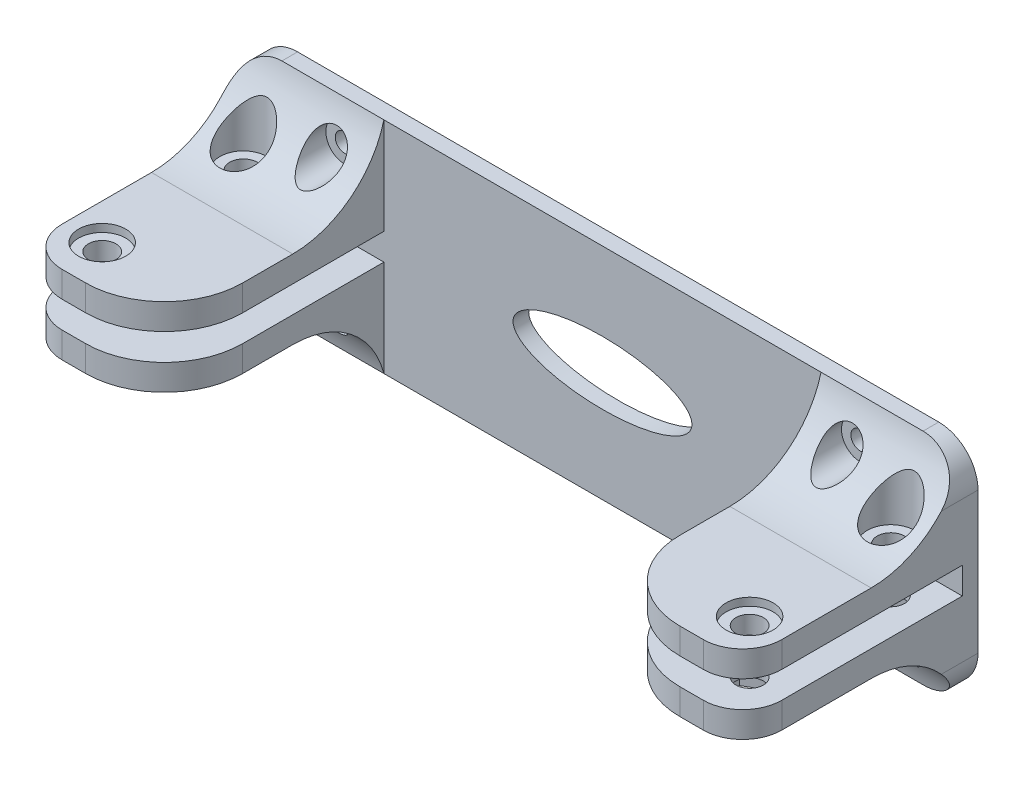
from build123d import *

# Parameters (mm, degrees)
SKETCH2_W           = 91.7
SKETCH2_H           = 28
SKETCH2_R           = 1.2
BOSS_EXTRUDE1_DEPTH = 2
SKETCH3_W           = 28
SKETCH3_H           = 10
BOSS_EXTRUDE2_DEPTH = 18
SKETCH4_R           = 1.75
CUT_EXTRUDE1_DEPTH  = 58.993297026
FILLET3_R           = 5
FILLET4_R           = 10
CUT_EXTRUDE2_REACH  = 58.553
SKETCH5_W           = 5
SKETCH5_H           = 3.4
SKETCH5_W_2         = 3
SKETCH5_W_3         = 10
FILLET1_R           = 12
SKETCH6_R           = 2.4
CUT_EXTRUDE3_DEPTH  = 56.517767534
SKETCH7_RX          = 11.396995787
SKETCH7_RY          = 4.035988973
CUT_EXTRUDE4_DEPTH  = 56.517767534
CUT_EXTRUDE5_START  = -2
CUT_EXTRUDE5_DEPTH  = 60.993297138
CUT_EXTRUDE6_START  = -1
SKETCH9_R           = 3
CUT_EXTRUDE6_DEPTH  = 59.993297138
FILLET5_R           = 5


with BuildPart() as part:
    # Sketch2 → Boss-Extrude1 (new body)
    with BuildSketch(Plane.XY):
        Rectangle(SKETCH2_W, SKETCH2_H)
        with Locations((-32.85, 9)):
            Circle(SKETCH2_R, mode=Mode.SUBTRACT)
        with Locations((-32.85, -9)):
            Circle(SKETCH2_R, mode=Mode.SUBTRACT)
        with Locations(Location((32.85, -9, 0), (0, 0, 180))):
            Circle(SKETCH2_R, mode=Mode.SUBTRACT)
        with Locations(Location((32.85, 9, 0), (0, 0, 180))):
            Circle(SKETCH2_R, mode=Mode.SUBTRACT)
    extrude(amount=BOSS_EXTRUDE1_DEPTH)

    # Sketch3 → Boss-Extrude2 (add)
    with BuildSketch(Plane.ZY.offset(45.85)):
        with Locations((16, 0)):
            Rectangle(SKETCH3_W, SKETCH3_H)
    boss_extrude2 = extrude(amount=-BOSS_EXTRUDE2_DEPTH)

    # Mirror1: Boss-Extrude2 across plane
    add(boss_extrude2.mirror(Plane.ZY))

    # Sketch4 → Cut-Extrude1 (cut, through all)
    with BuildSketch(Plane.XZ.offset(5)):
        with Locations(Location((-41.25, 24.5, 0), (0, 0, 270))):
            Circle(SKETCH4_R)
        with Locations(Location((-41.25, 6.5, 0), (0, 0, 270))):
            Circle(SKETCH4_R)
        with Locations(Location((41.25, 6.5, 0), (0, 0, 270))):
            Circle(SKETCH4_R)
        with Locations(Location((41.25, 24.5, 0), (0, 0, 270))):
            Circle(SKETCH4_R)
    extrude(amount=-CUT_EXTRUDE1_DEPTH, mode=Mode.SUBTRACT)

    # Fillet3
    fillet3_edges = [part.edges().sort_by_distance(p)[0] for p in [
        (-45.85, 0, 30),
        (45.85, 0, 30),
    ]]
    fillet(fillet3_edges, radius=FILLET3_R)

    # Fillet4
    fillet4_edges = [part.edges().sort_by_distance(p)[0] for p in [
        (-27.85, 0, 30),
        (27.85, 0, 30),
    ]]
    fillet(fillet4_edges, radius=FILLET4_R)

    # Cut-Extrude2: up to this face of the body (flat: up to its plane)
    cut_extrude2_end = Plane(part.part.faces().sort_by_distance((0, 0, 2))[0])
    # Sketch5 → Cut-Extrude2 (cut, up to the picked face)
    with BuildSketch(Plane.XY.offset(30), mode=Mode.PRIVATE) as cut_extrude2_sk1:
        with Locations((-43.35, 0)):
            Rectangle(SKETCH5_W, SKETCH5_H)
    cut_extrude2_tool1 = split(extrude(cut_extrude2_sk1.sketch, amount=-CUT_EXTRUDE2_REACH, mode=Mode.PRIVATE), bisect_by=cut_extrude2_end, keep=Keep.BOTH, mode=Mode.PRIVATE)
    # Sketch5 → Cut-Extrude2 (cut, up to the picked face)
    with BuildSketch(Plane.XY.offset(30), mode=Mode.PRIVATE) as cut_extrude2_sk2:
        with Locations((-39.35, 0)):
            Rectangle(SKETCH5_W_2, SKETCH5_H)
    cut_extrude2_tool2 = split(extrude(cut_extrude2_sk2.sketch, amount=-CUT_EXTRUDE2_REACH, mode=Mode.PRIVATE), bisect_by=cut_extrude2_end, keep=Keep.BOTH, mode=Mode.PRIVATE)
    # Sketch5 → Cut-Extrude2 (cut, up to the picked face)
    with BuildSketch(Plane.XY.offset(30), mode=Mode.PRIVATE) as cut_extrude2_sk3:
        with Locations((-32.85, 0)):
            Rectangle(SKETCH5_W_3, SKETCH5_H)
    cut_extrude2_tool3 = split(extrude(cut_extrude2_sk3.sketch, amount=-CUT_EXTRUDE2_REACH, mode=Mode.PRIVATE), bisect_by=cut_extrude2_end, keep=Keep.BOTH, mode=Mode.PRIVATE)
    cut_extrude2_1 = cut_extrude2_tool1.solids().sort_by(Axis((-43.35, 0, 30), (0, 0, -1)))[0]
    add(cut_extrude2_1, mode=Mode.SUBTRACT)
    cut_extrude2_2 = cut_extrude2_tool2.solids().sort_by(Axis((-39.35, 0, 30), (0, 0, -1)))[0]
    add(cut_extrude2_2, mode=Mode.SUBTRACT)
    cut_extrude2_3 = cut_extrude2_tool3.solids().sort_by(Axis((-32.85, 0, 30), (0, 0, -1)))[0]
    add(cut_extrude2_3, mode=Mode.SUBTRACT)
    cut_extrude2 = cut_extrude2_1 + cut_extrude2_2 + cut_extrude2_3  # Cut-Extrude2 as one shape, for the pattern or mirror that repeats it

    # Mirror2: Cut-Extrude2 across plane
    add(cut_extrude2.mirror(Plane.ZY), mode=Mode.SUBTRACT)

    # Fillet1
    # the kernel refuses this fillet: 12 mm, written as the material it adds along each edge
    with BuildSketch(Plane(origin=(45.85, -5, 2), x_dir=(0, -1, 0), z_dir=(-1, 0, 0))) as fillet1_piece_1_section:
        with BuildLine():
            CenterArc((12, 11.618950039), FILLET1_R, 180, 75.522487814)
            Line((0, 11.618950039), (-0.24, 11.618950039))
            Line((-0.24, 11.618950039), (-0.24, 0))
            Line((-0.24, 0), (0, -0.24))
            ThreePointArc((0, -0.24), (4.5, -0.24), (8.94, -0.232379001))
            Line((8.94, -0.232379001), (9, 0))
        make_face()
    fillet1_piece_1 = extrude(amount=18, mode=Mode.PRIVATE)
    fillet1_piece_1 = fillet1_piece_1 - Plane(origin=(32.85, -9, 4.70075026), x_dir=(-1, 0, 0), z_dir=(0, 0, -1)) * Cylinder(1.2, 83, mode=Mode.PRIVATE)
    fillet1_piece_1 = fillet1_piece_1 - Plane(origin=(41.25, -7.287586678, 6.5), x_dir=(0, 0, -1), z_dir=(0, -1, 0)) * Cylinder(1.75, 83, mode=Mode.PRIVATE)
    add(fillet1_piece_1)
    with BuildSketch(Plane(origin=(45.85, 5, 2), x_dir=(0, 1, 0), z_dir=(-1, 0, 0))) as fillet1_piece_2_section:
        with BuildLine():
            CenterArc((12, -11.618950039), FILLET1_R, 104.477512186, 75.522487814)
            Line((0, -11.618950039), (-0.24, -11.618950039))
            Line((-0.24, -11.618950039), (-0.24, 0))
            Line((-0.24, 0), (0, 0.24))
            ThreePointArc((0, 0.24), (4.5, 0.24), (8.94, 0.232379001))
            Line((8.94, 0.232379001), (9, 0))
        make_face()
    fillet1_piece_2 = extrude(amount=18, mode=Mode.PRIVATE)
    fillet1_piece_2 = fillet1_piece_2 - Plane(origin=(32.85, 9, 4.700755002), x_dir=(-1, 0, 0), z_dir=(0, 0, -1)) * Cylinder(1.2, 83, mode=Mode.PRIVATE)
    fillet1_piece_2 = fillet1_piece_2 - Plane(origin=(41.25, 7.287586336, 6.5), x_dir=(0, 0, -1), z_dir=(0, -1, 0)) * Cylinder(1.75, 83, mode=Mode.PRIVATE)
    add(fillet1_piece_2)
    with BuildSketch(Plane(origin=(-45.85, 5, 2), x_dir=(0, 0, 1), z_dir=(1, 0, 0))) as fillet1_piece_3_section:
        with BuildLine():
            CenterArc((11.618950039, -12), FILLET1_R, 90, 75.522487814)
            Line((0, -9), (-0.232379001, -8.94))
            ThreePointArc((-0.232379001, -8.94), (-0.24, -4.5), (-0.24, 0))
            Line((-0.24, 0), (0, 0.24))
            Line((0, 0.24), (11.618950039, 0.24))
            Line((11.618950039, 0.24), (11.618950039, 0))
        make_face()
    fillet1_piece_3 = extrude(amount=18, mode=Mode.PRIVATE)
    fillet1_piece_3 = fillet1_piece_3 - Plane(origin=(-41.25, 7.287581998, 6.5), x_dir=(0, 0, -1), z_dir=(0, -1, 0)) * Cylinder(1.75, 83, mode=Mode.PRIVATE)
    fillet1_piece_3 = fillet1_piece_3 - Plane(origin=(-32.85, 9, 4.700755464), x_dir=(1, 0, 0), z_dir=(0, 0, -1)) * Cylinder(1.2, 83, mode=Mode.PRIVATE)
    add(fillet1_piece_3)
    with BuildSketch(Plane(origin=(-45.85, -5, 2), x_dir=(0, -1, 0), z_dir=(1, 0, 0))) as fillet1_piece_4_section:
        with BuildLine():
            CenterArc((12, -11.618950039), FILLET1_R, 104.477512186, 75.522487814)
            Line((0, -11.618950039), (-0.24, -11.618950039))
            Line((-0.24, -11.618950039), (-0.24, 0))
            Line((-0.24, 0), (0, 0.24))
            ThreePointArc((0, 0.24), (4.5, 0.24), (8.94, 0.232379001))
            Line((8.94, 0.232379001), (9, 0))
        make_face()
    fillet1_piece_4 = extrude(amount=18, mode=Mode.PRIVATE)
    fillet1_piece_4 = fillet1_piece_4 - Plane(origin=(-32.85, -9, 4.700754814), x_dir=(1, 0, 0), z_dir=(0, 0, -1)) * Cylinder(1.2, 83, mode=Mode.PRIVATE)
    fillet1_piece_4 = fillet1_piece_4 - Plane(origin=(-41.25, -7.287586387, 6.5), x_dir=(0, 0, -1), z_dir=(0, -1, 0)) * Cylinder(1.75, 83, mode=Mode.PRIVATE)
    add(fillet1_piece_4)

    # Sketch6 → Cut-Extrude3 (cut, through all)
    with BuildSketch(Plane.XY.offset(2)):
        with Locations(Location((-32.85, 9, 0), (0, 0, 180))):
            Circle(SKETCH6_R)
        with Locations(Location((-32.85, -9, 0), (0, 0, 180))):
            Circle(SKETCH6_R)
        with Locations(Location((32.85, -9, 0), (0, 0, 180))):
            Circle(SKETCH6_R)
        with Locations(Location((32.85, 9, 0), (0, 0, 180))):
            Circle(SKETCH6_R)
    extrude(amount=CUT_EXTRUDE3_DEPTH, mode=Mode.SUBTRACT)

    # Sketch7 → Cut-Extrude4 (cut, through all)
    with BuildSketch(Plane.XY.offset(2)):
        with Locations((0, 0)):
            Ellipse(SKETCH7_RX, SKETCH7_RY)
    extrude(amount=-CUT_EXTRUDE4_DEPTH, mode=Mode.SUBTRACT)

    # Sketch8 → Cut-Extrude5 (cut)
    with BuildSketch(Plane.XZ.offset(5).offset(CUT_EXTRUDE5_START)):
        Polygon((-41.25, 27.964101615), (-44.25, 26.232050808), (-44.25, 22.767949192), (-41.25, 21.035898385), (-38.25, 22.767949192), (-38.25, 26.232050808), align=None)
        Polygon((-41.25, 9.964101615), (-44.25, 8.232050808), (-44.25, 4.767949192), (-41.25, 3.035898385), (-38.25, 4.767949192), (-38.25, 8.232050808), align=None)
    cut_extrude5 = extrude(amount=CUT_EXTRUDE5_DEPTH, mode=Mode.SUBTRACT)

    # Mirror3: Cut-Extrude5 across plane
    add(cut_extrude5.mirror(Plane.ZY), mode=Mode.SUBTRACT)

    # Sketch9 → Cut-Extrude6 (cut)
    with BuildSketch(Plane(origin=(0, 5, 0), x_dir=(1, 0, 0), z_dir=(0, 1, 0)).offset(CUT_EXTRUDE6_START)):
        with Locations(Location((-41.25, -24.5, 0), (0, 0, 270))):
            Circle(SKETCH9_R)
        with Locations(Location((-41.25, -6.5, 0), (0, 0, 90))):
            Circle(SKETCH9_R)
    cut_extrude6 = extrude(amount=CUT_EXTRUDE6_DEPTH, mode=Mode.SUBTRACT)

    # Mirror4: Cut-Extrude6 across plane
    add(cut_extrude6.mirror(Plane.ZY), mode=Mode.SUBTRACT)

    # Fillet5
    fillet5_edges = [part.edges().sort_by_distance(p)[0] for p in [
        (45.85, -14, 1),
        (-45.85, -14, 1),
        (-45.85, 14, 1),
        (45.85, 14, 1),
    ]]
    fillet(fillet5_edges, radius=FILLET5_R)


solid = part.part
